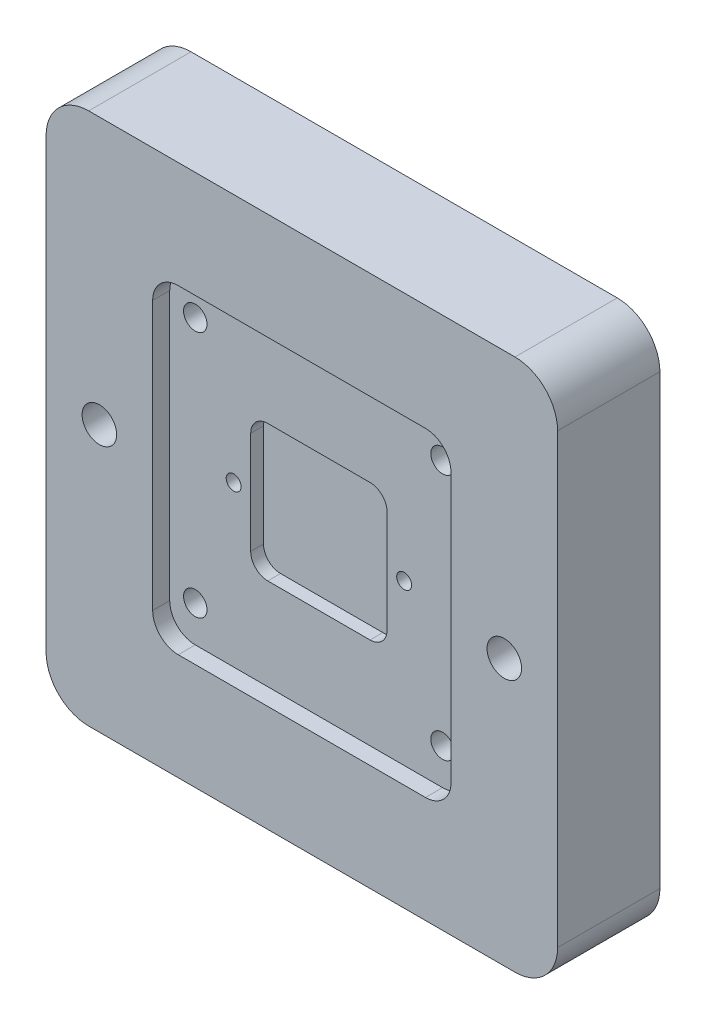
from build123d import *

# Parameters (mm, degrees)
BOSS_EXTRUDE1_DEPTH     = 4
BOSS_EXTRUDE2_DEPTH     = 20
CUT_EXTRUDE1_DEPTH      = 89.917096219
CUT_EXTRUDE1_DEPTH_BACK = 89.917096219
SKETCH8_R               = 2.75
CUT_EXTRUDE2_START      = -7
CUT_EXTRUDE2_DEPTH      = 97.901334807
CUT_EXTRUDE3_DEPTH      = 90.901334807
CUT_EXTRUDE3_DEPTH_BACK = 20
SKETCH10_R              = 4.05
CUT_EXTRUDE4_DEPTH      = 3
SKETCH14_R              = 1.75
CUT_EXTRUDE5_DEPTH      = 90.901334807
CUT_EXTRUDE6_DEPTH      = 3


with BuildPart() as part:
    # Sketch1 → Boss-Extrude1 (new body)
    with BuildSketch(Plane.XY):
        with BuildLine():
            Line((-50, 62.5), (50, 62.5))
            ThreePointArc((50, 62.5), (57.071067812, 59.571067812), (60, 52.5))
            Line((60, 52.5), (60, -52.5))
            ThreePointArc((60, -52.5), (57.071067812, -59.571067812), (50, -62.5))
            Line((50, -62.5), (-50, -62.5))
            ThreePointArc((-50, -62.5), (-57.071067812, -59.571067812), (-60, -52.5))
            Line((-60, -52.5), (-60, 52.5))
            ThreePointArc((-60, 52.5), (-57.071067812, 59.571067812), (-50, 62.5))
        make_face()
        with BuildLine():
            Line((-29, 37.5), (29, 37.5))
            ThreePointArc((29, 37.5), (33.242640687, 35.742640687), (35, 31.5))
            Line((35, 31.5), (35, -31.5))
            ThreePointArc((35, -31.5), (33.242640687, -35.742640687), (29, -37.5))
            Line((29, -37.5), (-29, -37.5))
            ThreePointArc((-29, -37.5), (-33.242640687, -35.742640687), (-35, -31.5))
            Line((-35, -31.5), (-35, 31.5))
            ThreePointArc((-35, 31.5), (-33.242640687, 35.742640687), (-29, 37.5))
        make_face(mode=Mode.SUBTRACT)
    extrude(amount=-BOSS_EXTRUDE1_DEPTH)

    # Sketch2 → Boss-Extrude2 (add)
    with BuildSketch(Plane.XY.offset(-4)):
        with BuildLine():
            Line((-50, -62.5), (50, -62.5))
            ThreePointArc((50, -62.5), (57.071067812, -59.571067812), (60, -52.5))
            Line((60, -52.5), (60, 52.5))
            ThreePointArc((60, 52.5), (57.071067812, 59.571067812), (50, 62.5))
            Line((50, 62.5), (-50, 62.5))
            ThreePointArc((-50, 62.5), (-57.071067812, 59.571067812), (-60, 52.5))
            Line((-60, 52.5), (-60, -52.5))
            ThreePointArc((-60, -52.5), (-57.071067812, -59.571067812), (-50, -62.5))
        make_face()
    extrude(amount=-BOSS_EXTRUDE2_DEPTH)

    # Sketch8 → Cut-Extrude1 (cut, two sides: drawn at the far end of the back side and taken through both)
    with BuildSketch(Plane.XY.offset(-4).offset(-CUT_EXTRUDE1_DEPTH_BACK)):
        with Locations((-29, 29)):
            Circle(SKETCH8_R)
        with Locations((29, 29)):
            Circle(SKETCH8_R)
        with Locations((29, -29)):
            Circle(SKETCH8_R)
        with Locations((-29, -29)):
            Circle(SKETCH8_R)
    extrude(amount=CUT_EXTRUDE1_DEPTH + CUT_EXTRUDE1_DEPTH_BACK, mode=Mode.SUBTRACT)

    # Sketch9 → Cut-Extrude2 (cut)
    with BuildSketch(Plane(origin=(0, 0, -24), x_dir=(-1, 0, 0), z_dir=(0, 0, -1)).offset(CUT_EXTRUDE2_START)):
        Polygon((-33.1, 26.632863896), (-29, 24.265727793), (-24.9, 26.632863896), (-24.9, 31.367136104), (-29, 33.734272207), (-33.1, 31.367136104), align=None)
    cut_extrude2 = extrude(amount=CUT_EXTRUDE2_DEPTH, mode=Mode.SUBTRACT)

    # Sketch-Pattern1: Cut-Extrude2 at 3 more places
    with Locations((-58, 0, 0), (0, -58, 0), (-58, -58, 0)):
        add(cut_extrude2, mode=Mode.SUBTRACT)

    # Sketch10 → Cut-Extrude3 (cut, two sides: drawn at the far end of the back side and taken through both)
    with BuildSketch(Plane.XY.offset(-CUT_EXTRUDE3_DEPTH_BACK)):
        with Locations((47.5, 0)):
            Circle(SKETCH10_R)
        with Locations((-47.5, 0)):
            Circle(SKETCH10_R)
    extrude(amount=CUT_EXTRUDE3_DEPTH + CUT_EXTRUDE3_DEPTH_BACK, mode=Mode.SUBTRACT)

    # Sketch11 → Cut-Extrude4 (cut)
    with BuildSketch(Plane.XY.offset(-4)):
        with BuildLine():
            Line((-12, 16), (12, 16))
            ThreePointArc((12, 16), (14.828427125, 14.828427125), (16, 12))
            Line((16, 12), (16, -12))
            ThreePointArc((16, -12), (14.828427125, -14.828427125), (12, -16))
            Line((12, -16), (-12, -16))
            ThreePointArc((-12, -16), (-14.828427125, -14.828427125), (-16, -12))
            Line((-16, -12), (-16, 12))
            ThreePointArc((-16, 12), (-14.828427125, 14.828427125), (-12, 16))
        make_face()
    extrude(amount=-CUT_EXTRUDE4_DEPTH, mode=Mode.SUBTRACT)

    # Sketch14 → Cut-Extrude5 (cut, through all)
    with BuildSketch(Plane.XY):
        with Locations((-20, 0)):
            Circle(SKETCH14_R)
        with Locations((20, 0)):
            Circle(SKETCH14_R)
    extrude(amount=-CUT_EXTRUDE5_DEPTH, mode=Mode.SUBTRACT)

    # Sketch15 → Cut-Extrude6 (cut)
    with BuildSketch(Plane(origin=(0, 0, -24), x_dir=(-1, 0, 0), z_dir=(0, 0, -1))):
        Polygon((-21.674315781, -2.9), (-18.325684219, -2.9), (-16.651368439, 0), (-18.325684219, 2.9), (-21.674315781, 2.9), (-23.348631561, 0), align=None)
        Polygon((21.674315781, -2.9), (23.348631561, 0), (21.674315781, 2.9), (18.325684219, 2.9), (16.651368439, 0), (18.325684219, -2.9), align=None)
    extrude(amount=-CUT_EXTRUDE6_DEPTH, mode=Mode.SUBTRACT)


solid = part.part
